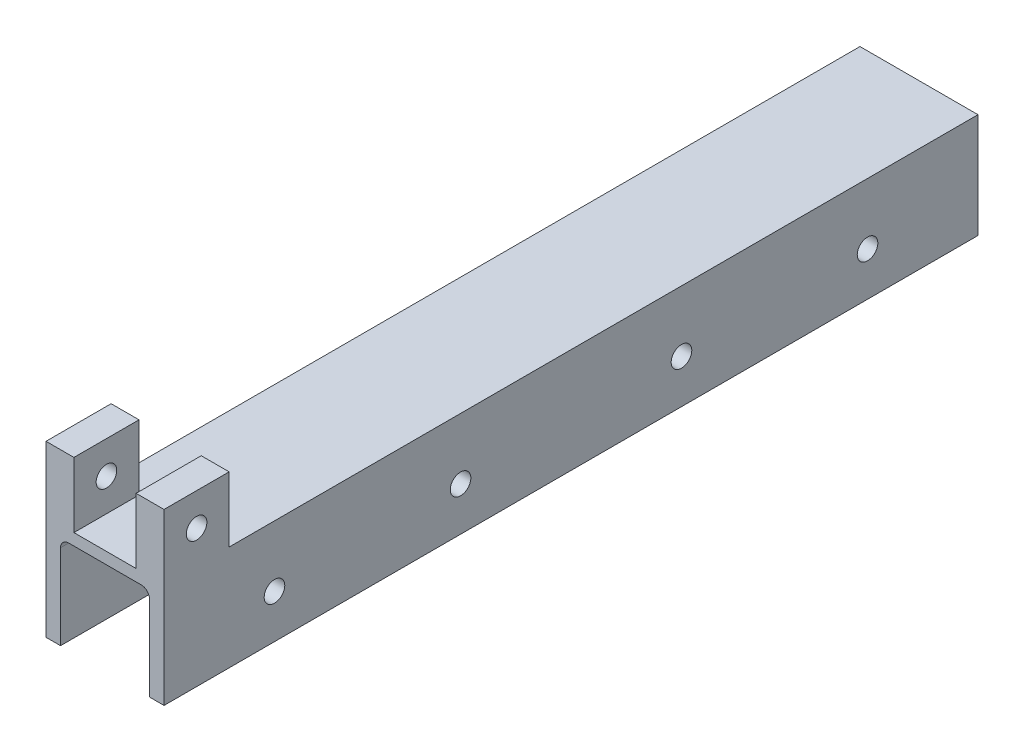
from build123d import *

# Parameters (mm, degrees)
BOSS_EXTRUDE2_DEPTH     = 177.8
SKETCH19_R              = 2.2479
CUT_EXTRUDE3_DEPTH      = 182.107922414
SKETCH21_W              = 6.096
SKETCH21_H              = 14.224
BOSS_EXTRUDE4_DEPTH     = 14.224
CUT_EXTRUDE4_DEPTH      = 183.689797966
CUT_EXTRUDE4_DEPTH_BACK = 183.689797966
SKETCH22_R              = 2.2479


with BuildPart() as part:
    # Sketch2 → Boss-Extrude2 (new body)
    with BuildSketch(Plane.XY):
        with BuildLine():
            Line((0, 0), (0, 22.86))
            Line((0, 22.86), (25.781, 22.86))
            Line((25.781, 22.86), (25.781, 0))
            Line((25.781, 0), (22.606, 0))
            Line((22.606, 0), (22.606, 18.542))
            ThreePointArc((22.606, 18.542), (22.085235857, 19.799235857), (20.828, 20.32))
            Line((20.828, 20.32), (4.953, 20.32))
            ThreePointArc((4.953, 20.32), (3.695764143, 19.799235857), (3.175, 18.542))
            Line((3.175, 18.542), (3.175, 0))
            Line((3.175, 0), (0, 0))
        make_face()
    extrude(amount=-BOSS_EXTRUDE2_DEPTH)

    # Sketch19 → Cut-Extrude3 (cut, through all)
    with BuildSketch(Plane(origin=(0, 0, 0), x_dir=(0, 0, -1), z_dir=(1, 0, 0))):
        with Locations((24.13, 9.525)):
            Circle(SKETCH19_R)
        with Locations((64.77, 9.525)):
            Circle(SKETCH19_R)
        with Locations((113.03, 9.525)):
            Circle(SKETCH19_R)
        with Locations((153.67, 9.525)):
            Circle(SKETCH19_R)
    extrude(amount=CUT_EXTRUDE3_DEPTH, mode=Mode.SUBTRACT)

    # Sketch21 → Boss-Extrude4 (add)
    with BuildSketch(Plane(origin=(0, 22.86, 0), x_dir=(1, 0, 0), z_dir=(0, 1, 0))):
        with Locations((3.048, 7.112)):
            Rectangle(SKETCH21_W, SKETCH21_H)
        with Locations((22.733, 7.112)):
            Rectangle(SKETCH21_W, SKETCH21_H)
    extrude(amount=BOSS_EXTRUDE4_DEPTH)

    # Sketch22 → Cut-Extrude4 (cut, two sides: drawn at the far end of the back side and taken through both)
    with BuildSketch(Plane.ZY.offset(-19.685).offset(-CUT_EXTRUDE4_DEPTH_BACK)):
        with Locations((-7.112, 29.972)):
            Circle(SKETCH22_R)
    extrude(amount=CUT_EXTRUDE4_DEPTH + CUT_EXTRUDE4_DEPTH_BACK, mode=Mode.SUBTRACT)


solid = part.part
